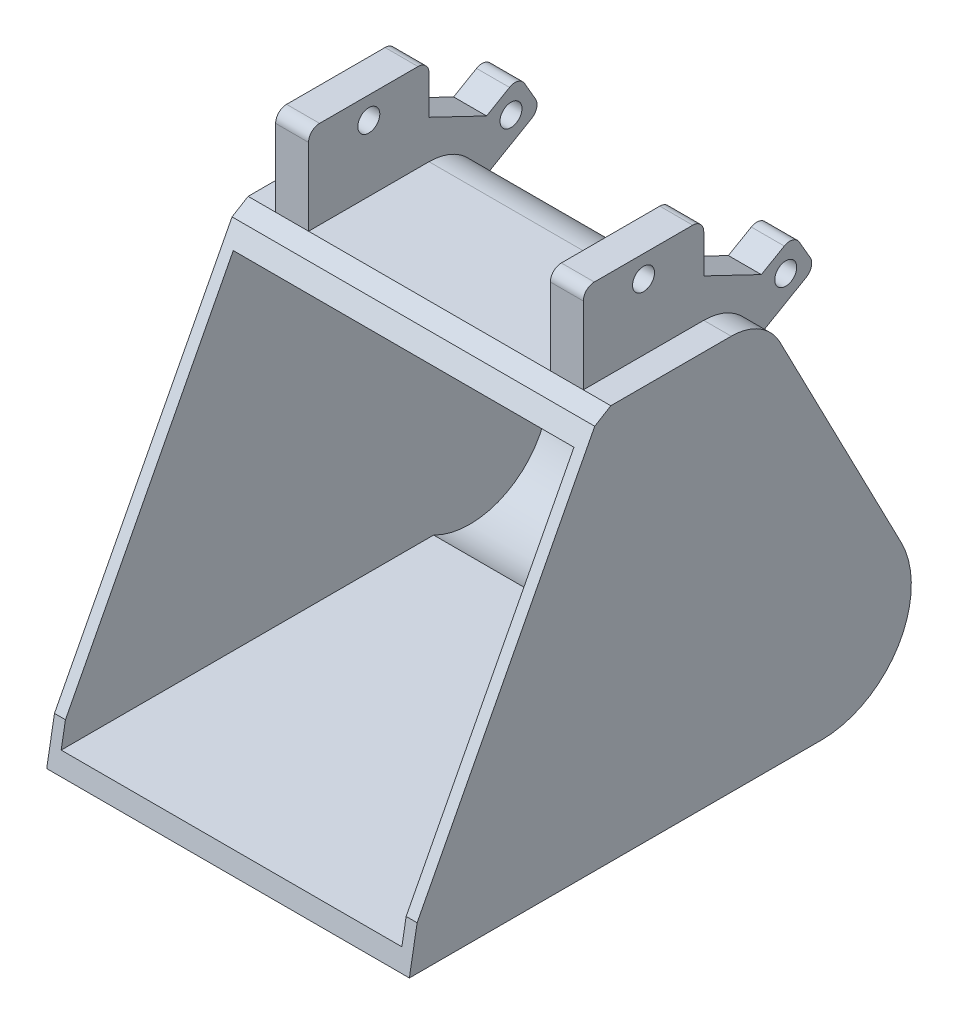
from build123d import *

# Parameters (mm, degrees)
BOSS_EXTRUDE1_DEPTH = 419.1
SHELL1_START        = 12.7
SHELL1_DEPTH        = 393.7
BOSS_EXTRUDE3_START = -69.85
SKETCH3_R           = 12.7
BOSS_EXTRUDE3_DEPTH = 38.1
SCALE3_SCALE        = 3


# Read off the part's stored shape, not the designer's step: Shell1
with BuildPart() as part:
    # Sketch1 → Boss-Extrude1 (new body)
    with BuildSketch(Plane(origin=(0, 0, 0), x_dir=(0, 0, -1), z_dir=(1, 0, 0))):
        with BuildLine():
            Line((0, 0), (476.25, 0))
            ThreePointArc((476.25, 0), (564.93634732, 49.85994299), (568.425328349, 151.541352929))
            Line((568.425328349, 151.541352929), (428.331493685, 422.044080755))
            ThreePointArc((428.331493685, 422.044080755), (404.943942228, 447.093648811), (371.944875703, 456.341352929))
            Line((371.944875703, 456.341352929), (232.768876591, 456.341352929))
            Line((232.768876591, 456.341352929), (214.204669203, 445.076315348))
            Line((214.204669203, 445.076315348), (8.95741062, 50.8))
            Line((8.95741062, 50.8), (0, 0))
        make_face()
    extrude(amount=BOSS_EXTRUDE1_DEPTH)

    # Shell1 outline → Shell1 (cut)
    with BuildSketch(Plane.YZ.offset(SHELL1_START)):
        with BuildLine():
            Line((22.86, -4.030834779), (22.86, -434.440917972))
            ThreePointArc((22.86, -434.440917972), (39.418714995, -540.70503827), (145.700807364, -557.148004752))
            Line((145.700807364, -557.148004752), (416.20353519, -417.054170089))
            ThreePointArc((416.20353519, -417.054170089), (436.243189635, -398.344128923), (443.641352929, -371.944875703))
            Line((443.641352929, -371.944875703), (443.641352929, -236.320754436))
            Line((443.641352929, -236.320754436), (423.361553833, -202.900679848))
            Line((423.361553833, -202.900679848), (50.8, -8.95741062))
            Line((50.8, -8.95741062), (22.86, -4.030834779))
        make_face()
    extrude(amount=SHELL1_DEPTH, mode=Mode.SUBTRACT)

    # Sketch3 → Boss-Extrude3 (add)
    with BuildSketch(Plane(origin=(419.1, 0, 0), x_dir=(0, 0, -1), z_dir=(1, 0, 0)).offset(BOSS_EXTRUDE3_START)):
        with BuildLine():
            Line((232.768876591, 545.241352929), (232.768876591, 456.341352929))
            Line((232.768876591, 456.341352929), (371.944875703, 456.341352929))
            ThreePointArc((371.944875703, 456.341352929), (404.943942228, 447.093648811), (428.331493685, 422.044080755))
            Line((428.331493685, 422.044080755), (435.388694544, 408.417556164))
            Line((435.388694544, 408.417556164), (490.381307684, 440.167556164))
            ThreePointArc((490.381307684, 440.167556164), (496.298565678, 447.879076919), (495.029830312, 457.516078792))
            Line((495.029830312, 457.516078792), (482.329830312, 479.513124048))
            ThreePointArc((482.329830312, 479.513124048), (474.618309557, 485.430382042), (464.981307684, 484.161646676))
            Line((464.981307684, 484.161646676), (438.491684026, 468.867855326))
            Line((438.491684026, 468.867855326), (371.944875703, 500.791352929))
            Line((371.944875703, 500.791352929), (371.944875703, 545.241352929))
            ThreePointArc((371.944875703, 545.241352929), (368.225131824, 554.22160905), (359.244875703, 557.941352929))
            Line((359.244875703, 557.941352929), (245.468876591, 557.941352929))
            ThreePointArc((245.468876591, 557.941352929), (236.48862047, 554.22160905), (232.768876591, 545.241352929))
        make_face()
        with Locations((302.356876147, 532.541352929)):
            Circle(SKETCH3_R, mode=Mode.SUBTRACT)
        with Locations((466.682785056, 455.81460142)):
            Circle(SKETCH3_R, mode=Mode.SUBTRACT)
    boss_extrude3 = extrude(amount=BOSS_EXTRUDE3_DEPTH)

    # Mirror1: Boss-Extrude3 across plane
    add(boss_extrude3.mirror(Plane(origin=(209.55, 0, 0), x_dir=(0, 0, 1), z_dir=(1, 0, 0))))


with BuildPart() as part_1:
    # Scale3: scaled about (209.55, 190.419755822, -326.126976247)
    add(part.part.scale(SCALE3_SCALE).moved(Location((-419.1, -380.839511644, 652.253952494))))


solid = part_1.part
